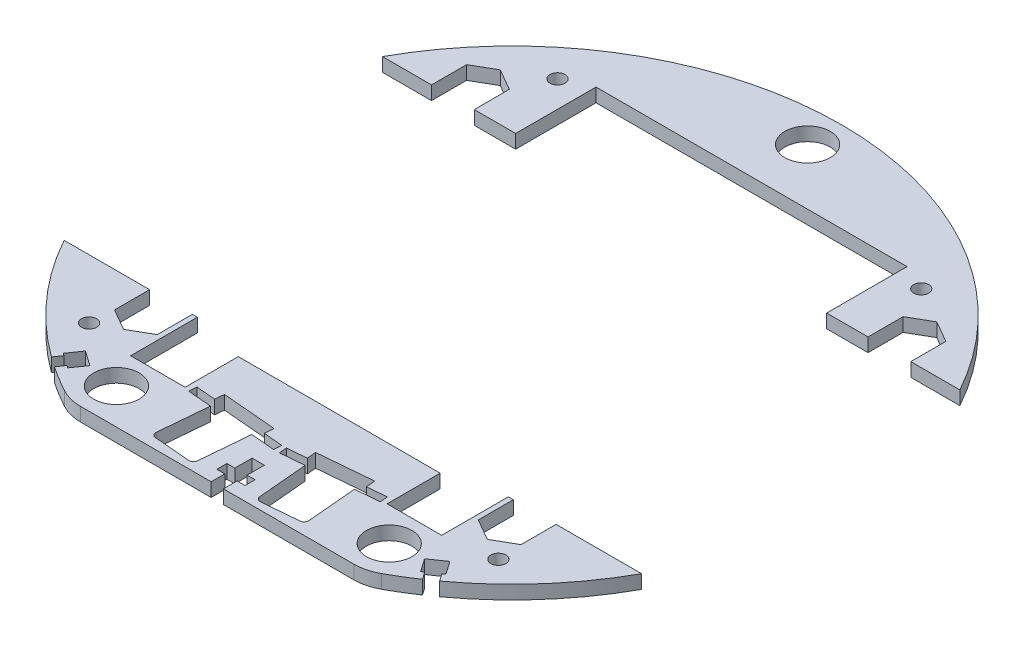
from build123d import *

# Parameters (mm, degrees)
BOSS_EXTRUDE1_DEPTH = 3
CUT_EXTRUDE1_DEPTH  = 103.574363269
SKETCH3_W           = 38.3
SKETCH3_H           = 70
CUT_EXTRUDE2_DEPTH  = 103.574363269
CUT_EXTRUDE3_DEPTH  = 97.418359248
CUT_EXTRUDE4_DEPTH  = 97.418359248
SKETCH6_W           = 68.4
SKETCH6_H           = 3
CUT_EXTRUDE5_DEPTH  = 97.418359248
SKETCH7_R           = 5
CUT_EXTRUDE6_DEPTH  = 97.418359248
CUT_EXTRUDE7_DEPTH  = 97.418359248
SKETCH11_R          = 5
CUT_EXTRUDE10_DEPTH = 97.418359248
CUT_EXTRUDE11_DEPTH = 97.418359248
SKETCH13_R          = 1.65
CUT_EXTRUDE12_DEPTH = 97.418359248
CUT_EXTRUDE13_DEPTH = 97.418359248


with BuildPart() as part:
    # Sketch1 → Boss-Extrude1 (new body)
    with BuildSketch(Plane(origin=(0, 0, 0), x_dir=(1, 0, 0), z_dir=(0, 1, 0))):
        with BuildLine():
            Line((-30.029977361, -64.812867647), (30.029977361, -64.812867647))
            ThreePointArc((30.029977361, -64.812867647), (32.509837414, -64.500503794), (34.834773739, -63.582926471))
            ThreePointArc((34.834773739, -63.582926471), (0, 72.5), (-34.834773739, -63.582926471))
            ThreePointArc((-34.834773739, -63.582926471), (-32.509837414, -64.500503794), (-30.029977361, -64.812867647))
        make_face()
    extrude(amount=BOSS_EXTRUDE1_DEPTH)

    # Sketch2 → Cut-Extrude1 (cut, through all)
    with BuildSketch(Plane(origin=(0, 3, 0), x_dir=(1, 0, 0), z_dir=(0, 1, 0))):
        Polygon((-34.2, -49.675685802), (-22.2, -49.675685802), (-22.2, -38), (22.2, -38), (22.2, -49.675685802), (34.2, -49.675685802), (34.2, 49.675685802), (22.2, 49.675685802), (22.2, 44), (-22.2, 44), (-22.2, 49.675685802), (-34.2, 49.675685802), align=None)
    extrude(amount=-CUT_EXTRUDE1_DEPTH, mode=Mode.SUBTRACT)

    # Sketch3 → Cut-Extrude2 (cut, through all)
    with BuildSketch(Plane(origin=(0, 3, 0), x_dir=(1, 0, 0), z_dir=(0, 1, 0))):
        with Locations((-53.35, 0)):
            Rectangle(SKETCH3_W, SKETCH3_H)
        with Locations((53.35, 0)):
            Rectangle(SKETCH3_W, SKETCH3_H)
    extrude(amount=-CUT_EXTRUDE2_DEPTH, mode=Mode.SUBTRACT)


with BuildPart() as cut_extrude2_piece_1:
    # of the separate pieces the step leaves, piece 1, a body of its own (cut_extrude2_pieces)
    add(part.part.solids().sort_by_distance((63.492125496, 0, -35))[0])

    # Sketch6 → Cut-Extrude5 (cut, through all)
    with BuildSketch(Plane(origin=(0, 3, 0), x_dir=(1, 0, 0), z_dir=(0, 1, 0))):
        with Locations((0, 51.175685802)):
            Rectangle(SKETCH6_W, SKETCH6_H)
    extrude(amount=-CUT_EXTRUDE5_DEPTH, mode=Mode.SUBTRACT)


with BuildPart() as cut_extrude2_piece_2:
    # of the separate pieces the step leaves, piece 2, a body of its own (cut_extrude2_pieces)
    add(part.part.solids().sort_by_distance((-34.834773739, 0, 63.582926471))[0])

    # Sketch4 → Cut-Extrude3 (cut, through all)
    with BuildSketch(Plane(origin=(0, 3, 0), x_dir=(1, 0, 0), z_dir=(0, 1, 0))):
        Polygon((-21.070156074, -50.026174921), (-0.648164763, -51.812867647), (-0.5, -50.11933666), (-20.921991311, -48.332643934), align=None)
        Polygon((21.070156074, -50.026174921), (20.921991311, -48.332643934), (0.5, -50.11933666), (0.648164763, -51.812867647), align=None)
    extrude(amount=-CUT_EXTRUDE3_DEPTH, mode=Mode.SUBTRACT)

    # Sketch5 → Cut-Extrude4 (cut, through all)
    with BuildSketch(Plane(origin=(0, 3, 0), x_dir=(1, 0, 0), z_dir=(0, 1, 0))):
        with BuildLine():
            Line((5.878186928, -51.355299998), (15.840133909, -50.48374257))
            Line((15.840133909, -50.48374257), (16.798847079, -61.441884249))
            ThreePointArc((16.798847079, -61.441884249), (16.568696824, -62.171827602), (15.889808123, -62.52523469))
            Line((15.889808123, -62.52523469), (7.920250539, -63.222480632))
            ThreePointArc((7.920250539, -63.222480632), (7.190307186, -62.992330377), (6.836900098, -62.313441677))
            Line((6.836900098, -62.313441677), (5.878186928, -51.355299998))
        make_face()
        Polygon((16.688163844, -48.703055841), (4.733827467, -49.748924754), (4.559515981, -47.756535357), (16.513852358, -46.710666444), align=None)
        Polygon((-16.513852358, -46.710666444), (-4.559515981, -47.756535357), (-4.733827467, -49.748924754), (-16.688163844, -48.703055841), align=None)
        with BuildLine():
            Line((-7.920250539, -63.222480632), (-15.889808123, -62.52523469))
            ThreePointArc((-15.889808123, -62.52523469), (-16.568696824, -62.171827602), (-16.798847079, -61.441884249))
            Line((-16.798847079, -61.441884249), (-15.840133909, -50.48374257))
            Line((-15.840133909, -50.48374257), (-5.878186928, -51.355299998))
            Line((-5.878186928, -51.355299998), (-6.836900098, -62.313441677))
            ThreePointArc((-6.836900098, -62.313441677), (-7.190307186, -62.992330377), (-7.920250539, -63.222480632))
        make_face()
    extrude(amount=-CUT_EXTRUDE4_DEPTH, mode=Mode.SUBTRACT)

    # Sketch7 → Cut-Extrude6 (cut, through all)
    with BuildSketch(Plane(origin=(0, 3, 0), x_dir=(1, 0, 0), z_dir=(0, 1, 0))):
        with Locations((-30, -57)):
            Circle(SKETCH7_R)
        with Locations((30, -57)):
            Circle(SKETCH7_R)
    extrude(amount=-CUT_EXTRUDE6_DEPTH, mode=Mode.SUBTRACT)


with BuildPart() as cut_extrude5_kept_piece:
    # of the separate pieces the step leaves, the one the design keeps (cut_extrude5_pieces_kept)
    add(cut_extrude2_piece_1.part.solids().sort_by_distance((63.492125496, 0, -35))[0])


with BuildPart() as cut_extrude7_tool:
    # Sketch8 → Cut-Extrude7 (new, through all)
    with BuildSketch(Plane(origin=(0, 3, 0), x_dir=(1, 0, 0), z_dir=(0, 1, 0))):
        Polygon((-52.7, 37.286453735), (-52.7, 32.5), (-43.3, 32.5), (-43.3, 37.286453735), (-43.3, 42.713546265), (-48, 45.42709253), (-52.7, 42.713546265), align=None)
        Polygon((44.7, -32.5), (35.3, -32.5), (35.3, -37.286453735), (35.3, -42.713546265), (40, -45.42709253), (44.7, -42.713546265), (44.7, -37.286453735), align=None)
        Polygon((-35.3, -37.286453735), (-35.3, -32.5), (-44.7, -32.5), (-44.7, -37.286453735), (-44.7, -42.713546265), (-40, -45.42709253), (-35.3, -42.713546265), align=None)
        Polygon((52.7, 32.5), (52.7, 37.286453735), (52.7, 42.713546265), (48, 45.42709253), (43.3, 42.713546265), (43.3, 37.286453735), (43.3, 32.5), align=None)
    extrude(amount=-CUT_EXTRUDE7_DEPTH)


with BuildPart() as cut_extrude2_piece_2_1:
    add(cut_extrude2_piece_2.part)

    # Cut-Extrude7: cut by cut_extrude7_tool
    add(cut_extrude7_tool.part, mode=Mode.SUBTRACT)

    # Sketch12 → Cut-Extrude11 (cut, through all)
    with BuildSketch(Plane(origin=(0, 3, 0), x_dir=(1, 0, 0), z_dir=(0, 1, 0))):
        Polygon((-1.35, -64.812867647), (1.35, -64.812867647), (1.35, -61.812867647), (3.1, -61.812867647), (3.1, -59.612867647), (1.35, -59.612867647), (1.35, -55.812867647), (-1.35, -55.812867647), (-1.35, -59.612867647), (-3.1, -59.612867647), (-3.1, -61.812867647), (-1.35, -61.812867647), align=None)
    extrude(amount=-CUT_EXTRUDE11_DEPTH, mode=Mode.SUBTRACT)


with BuildPart() as cut_extrude5_kept_piece_1:
    add(cut_extrude5_kept_piece.part)

    # Cut-Extrude7: cut by cut_extrude7_tool
    add(cut_extrude7_tool.part, mode=Mode.SUBTRACT)

    # Sketch11 → Cut-Extrude10 (cut, through all)
    with BuildSketch(Plane(origin=(0, 3, 0), x_dir=(1, 0, 0), z_dir=(0, 1, 0))):
        with Locations((0, 65)):
            Circle(SKETCH11_R)
    extrude(amount=-CUT_EXTRUDE10_DEPTH, mode=Mode.SUBTRACT)


with BuildPart() as cut_extrude12_tool:
    # Sketch13 → Cut-Extrude12 (new, through all)
    with BuildSketch(Plane(origin=(0, 3, 0), x_dir=(1, 0, 0), z_dir=(0, 1, 0))):
        with Locations((45, -48)):
            Circle(SKETCH13_R)
        with Locations((-45, -48)):
            Circle(SKETCH13_R)
        with Locations((40, 50)):
            Circle(SKETCH13_R)
        with Locations((-40, 50)):
            Circle(SKETCH13_R)
    extrude(amount=-CUT_EXTRUDE12_DEPTH)


with BuildPart() as cut_extrude2_piece_2_2:
    add(cut_extrude2_piece_2_1.part)

    # Cut-Extrude12: cut by cut_extrude12_tool
    add(cut_extrude12_tool.part, mode=Mode.SUBTRACT)

    # Sketch14 → Cut-Extrude13 (cut, through all)
    with BuildSketch(Plane.XZ):
        Polygon((-41.542994023, 56.975890933), (-42.075442851, 56.60306625), (-40.067925324, 53.736034095), (-36.791317147, 56.03033984), (-38.798834674, 58.897371995), (-39.331283503, 58.524547311), (-40.478436376, 60.1628514), (-42.690146895, 58.614195022), align=None)
        Polygon((41.542994023, 56.975890933), (42.690146895, 58.614195022), (40.478436376, 60.1628514), (39.331283503, 58.524547311), (38.798834674, 58.897371995), (36.791317147, 56.03033984), (40.067925324, 53.736034095), (42.075442851, 56.60306625), align=None)
    extrude(amount=-CUT_EXTRUDE13_DEPTH, mode=Mode.SUBTRACT)


with BuildPart() as cut_extrude5_kept_piece_2:
    add(cut_extrude5_kept_piece_1.part)

    # Cut-Extrude12: cut by cut_extrude12_tool
    add(cut_extrude12_tool.part, mode=Mode.SUBTRACT)


solid = Compound([cut_extrude2_piece_2_2.part, cut_extrude5_kept_piece_2.part])
